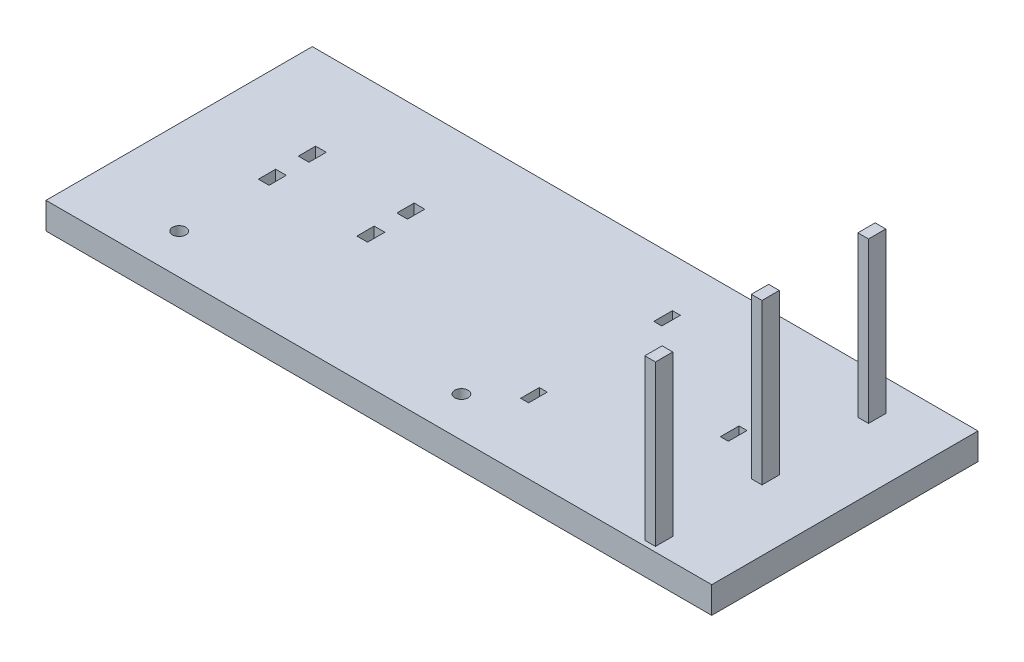
from build123d import *

# Parameters (mm, degrees)
SKETCH1_W           = 25
SKETCH1_H           = 10
BOSS_EXTRUDE1_DEPTH = 1
SKETCH2_R           = 0.25
SKETCH2_W           = 0.4
SKETCH2_H           = 0.65
SKETCH2_W_2         = 0.3
SKETCH2_H_2         = 0.7
CUT_EXTRUDE1_DEPTH  = 1
SKETCH3_W           = 0.4
SKETCH3_H           = 0.65
BOSS_EXTRUDE2_DEPTH = 6


with BuildPart() as part:
    # Sketch1 → Boss-Extrude1 (new body)
    with BuildSketch(Plane(origin=(0, 0, 0), x_dir=(1, 0, 0), z_dir=(0, 1, 0))):
        Rectangle(SKETCH1_W, SKETCH1_H)
    extrude(amount=BOSS_EXTRUDE1_DEPTH)

    # Sketch2 → Cut-Extrude1 (cut)
    with BuildSketch(Plane.XZ):
        with Locations((-9, 3.5)):
            Circle(SKETCH2_R)
        with Locations((1.6, 3.5)):
            Circle(SKETCH2_R)
        with Locations((-9, 0)):
            Rectangle(SKETCH2_W, SKETCH2_H)
        with Locations((-9, -1.5)):
            Rectangle(SKETCH2_W, SKETCH2_H)
        with Locations((-5.3, 0)):
            Rectangle(SKETCH2_W, SKETCH2_H)
        with Locations((-5.3, -1.5)):
            Rectangle(SKETCH2_W, SKETCH2_H)
        with Locations((8, -0.325)):
            Rectangle(SKETCH2_W_2, SKETCH2_H_2)
        with Locations((3, 2.175)):
            Rectangle(SKETCH2_W_2, SKETCH2_H_2)
        with Locations((3, -2.825)):
            Rectangle(SKETCH2_W_2, SKETCH2_H_2)
    extrude(amount=-CUT_EXTRUDE1_DEPTH, mode=Mode.SUBTRACT)

    # Sketch3 → Boss-Extrude2 (add)
    with BuildSketch(Plane(origin=(0, 1, 0), x_dir=(1, 0, 0), z_dir=(0, 1, 0))):
        with Locations((10, -0.487564974)):
            Rectangle(SKETCH3_W, SKETCH3_H)
        with Locations((10, 3.512435026)):
            Rectangle(SKETCH3_W, SKETCH3_H)
        with Locations((10, -4.487564974)):
            Rectangle(SKETCH3_W, SKETCH3_H)
    extrude(amount=BOSS_EXTRUDE2_DEPTH)


solid = part.part
